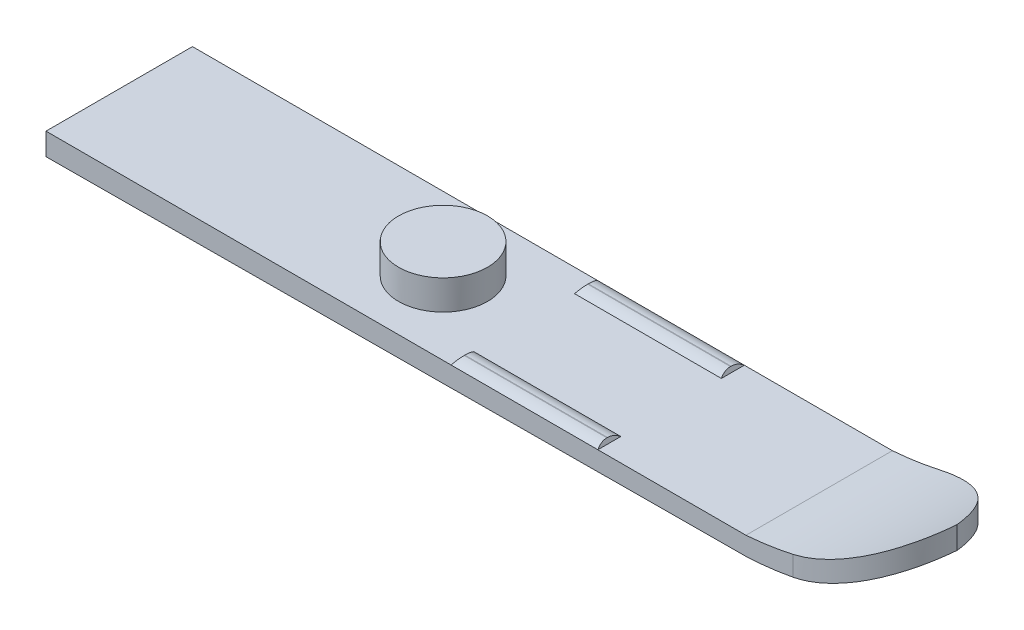
from build123d import *

# Parameters (mm, degrees)
SKATEBOARDBASE_DEPTH         = 7.9
CURVEDFRONT_R                = 5
SKETCH2_R                    = 2.4
STUD_DEPTH                   = 1.6
SKETCH3_W                    = 7.922196178
SKETCH3_H                    = 1.23692935
UPPERNOTCHES_DEPTH           = 0.2
UPPERNOTCHES_DRAFT           = 30
UPPERNOTCHES_PROFILE_2_DEPTH = 0.2
UPPERNOTCHES_PROFILE_2_DRAFT = 30
NOTCHFILLET_R                = 1
SKETCH4_R                    = 1.2
UNDERSTUDHOLE_DEPTH          = 1.6


with BuildPart() as part:
    # Sketch1 → SkateBoardBase (new body)
    with BuildSketch(Plane.XY):
        with BuildLine():
            Line((-20.371469293, 0.013768995), (17.388032716, 0.222549812))
            ThreePointArc((17.388032716, 0.222549812), (21.281619196, 0.833021385), (24.938309637, 2.303159558))
            Line((24.938309637, 2.303159558), (24.938309637, 3.514270646))
            ThreePointArc((24.938309637, 3.514270646), (21.290682244, 1.944239503), (17.388032716, 1.209726022))
            Line((17.388032716, 1.209726022), (-20.371469293, 1.209726022))
            Line((-20.371469293, 1.209726022), (-20.371469293, 0.013768995))
        make_face()
    extrude(amount=SKATEBOARDBASE_DEPTH)

    # CurvedFront
    # the kernel refuses this fillet: 5 mm, written as the material it takes off along each edge
    with BuildSketch(Plane(origin=(24.938309637, -10.196840442, 0), x_dir=(0, 0, 1), z_dir=(0, 1, 0))) as curvedfront_piece_1:
        with BuildLine():
            CenterArc((CURVEDFRONT_R, -CURVEDFRONT_R), CURVEDFRONT_R, 90, 90)
            Line((0, -CURVEDFRONT_R), (0, 0))
            Line((0, 0), (CURVEDFRONT_R, 0))
        make_face()
    extrude(amount=26.211111088, mode=Mode.SUBTRACT)
    with BuildSketch(Plane(origin=(24.938309637, -10.196840442, 7.9), x_dir=(0, 0, -1), z_dir=(0, 1, 0))) as curvedfront_piece_2:
        with BuildLine():
            CenterArc((CURVEDFRONT_R, CURVEDFRONT_R), CURVEDFRONT_R, 180, 90)
            Line((0, CURVEDFRONT_R), (0, 0))
            Line((0, 0), (CURVEDFRONT_R, 0))
        make_face()
    extrude(amount=26.211111088, mode=Mode.SUBTRACT)

    # Sketch2 → Stud (add)
    with BuildSketch(Plane(origin=(0, 1.209726022, 0), x_dir=(1, 0, 0), z_dir=(0, 1, 0))):
        with Locations(Location((-2.902006395, -3.95, 0), (0, 0, 90))):
            Circle(SKETCH2_R)
    extrude(amount=STUD_DEPTH)


with BuildPart() as uppernotches_tool:
    # Sketch3 → UpperNotches (with draft: the straight prism first)
    with BuildSketch(Plane(origin=(0, 1.209726022, 0), x_dir=(1, 0, 0), z_dir=(0, 1, 0))):
        with Locations((5.4387323, -0.618464675)):
            Rectangle(SKETCH3_W, SKETCH3_H)
    extrude(amount=UPPERNOTCHES_DEPTH)
    # UpperNotches: the draft: its side faces are tilted about the plane it starts from
    uppernotches_sides = [uppernotches_tool.faces().sort_by_distance(p)[0] for p in [
        (1.477634211, 1.309726022, 0.618464675),
        (5.4387323, 1.309726022, 1.23692935),
        (9.399830389, 1.309726022, 0.618464675),
        (5.4387323, 1.309726022, 0),
    ]]
    draft(uppernotches_sides, Plane(origin=(0, 1.209726022, 0), x_dir=(1, 0, 0), z_dir=(0, 1, 0)), UPPERNOTCHES_DRAFT)


with BuildPart() as part_1:
    add(part.part)

    # UpperNotches: add uppernotches_tool
    add(uppernotches_tool.part)


with BuildPart() as uppernotches_profile_2_tool:
    # Sketch3 → UpperNotches profile 2 (with draft: the straight prism first)
    with BuildSketch(Plane(origin=(0, 1.209726022, 0), x_dir=(1, 0, 0), z_dir=(0, 1, 0))):
        with Locations((5.4387323, -7.281535325)):
            Rectangle(SKETCH3_W, SKETCH3_H)
    extrude(amount=UPPERNOTCHES_PROFILE_2_DEPTH)
    # UpperNotches profile 2: the draft: its side faces are tilted about the plane it starts from
    uppernotches_profile_2_sides = [uppernotches_profile_2_tool.faces().sort_by_distance(p)[0] for p in [
        (5.4387323, 1.309726022, 6.66307065),
        (1.477634211, 1.309726022, 7.281535325),
        (5.4387323, 1.309726022, 7.9),
        (9.399830389, 1.309726022, 7.281535325),
    ]]
    draft(uppernotches_profile_2_sides, Plane(origin=(0, 1.209726022, 0), x_dir=(1, 0, 0), z_dir=(0, 1, 0)), UPPERNOTCHES_PROFILE_2_DRAFT)


with BuildPart() as part_2:
    add(part_1.part)

    # UpperNotches profile 2: add uppernotches_profile_2_tool
    add(uppernotches_profile_2_tool.part)

    # NotchFillet
    # the kernel refuses this fillet: 1 mm, written as the material it takes off along each edge
    with BuildSketch(Plane(origin=(0.381779399, 1.409726022, 1.121459296), x_dir=(0, -0.8660254037844376, 0.5000000000000017), z_dir=(1, 0, 0)), Plane(origin=(10.4956852, 1.409726022, 0.115470054), x_dir=(0, -0.8660254037844383, -0.5000000000000008), z_dir=(-1, 0, 0)), Plane(origin=(0.381779399, 1.409726022, 7.784529946), x_dir=(0, -0.8660254037844378, 0.5000000000000013), z_dir=(1, 0, 0)), Plane(origin=(10.4956852, 1.409726022, 6.778540704), x_dir=(0, -0.8660254037844378, -0.5000000000000013), z_dir=(-1, 0, 0))) as notchfillet_piece_1:
        with BuildLine():
            CenterArc((0.623760431, 0.919615242), NOTCHFILLET_R, 210, 36.869897646)
            Line((-0.242264973, 0.419615242), (-0.259585481, 0.409615242))
            Line((-0.259585481, 0.409615242), (-0.017320508, -0.01))
            Line((-0.017320508, -0.01), (0, -0.02))
            ThreePointArc((0, -0.02), (0.115470054, -0.02), (0.223083701, -0.018392305))
            Line((0.223083701, -0.018392305), (0.230940108, 0))
        make_face()
    extrude(amount=10.113905801, mode=Mode.SUBTRACT)

    # Sketch4 → UnderStudHole (cut)
    with BuildSketch(Plane(origin=(-0.000698914, 0.126403586, 0), x_dir=(-0.9999847141809186, -0.005529141389625959, 0), z_dir=(0.005529141389625959, -0.9999847141809186, 0))):
        with Locations(Location((2.895273289, -3.95, 0), (0, 0, 180))):
            Circle(SKETCH4_R)
    extrude(amount=-UNDERSTUDHOLE_DEPTH, mode=Mode.SUBTRACT)


solid = part_2.part
